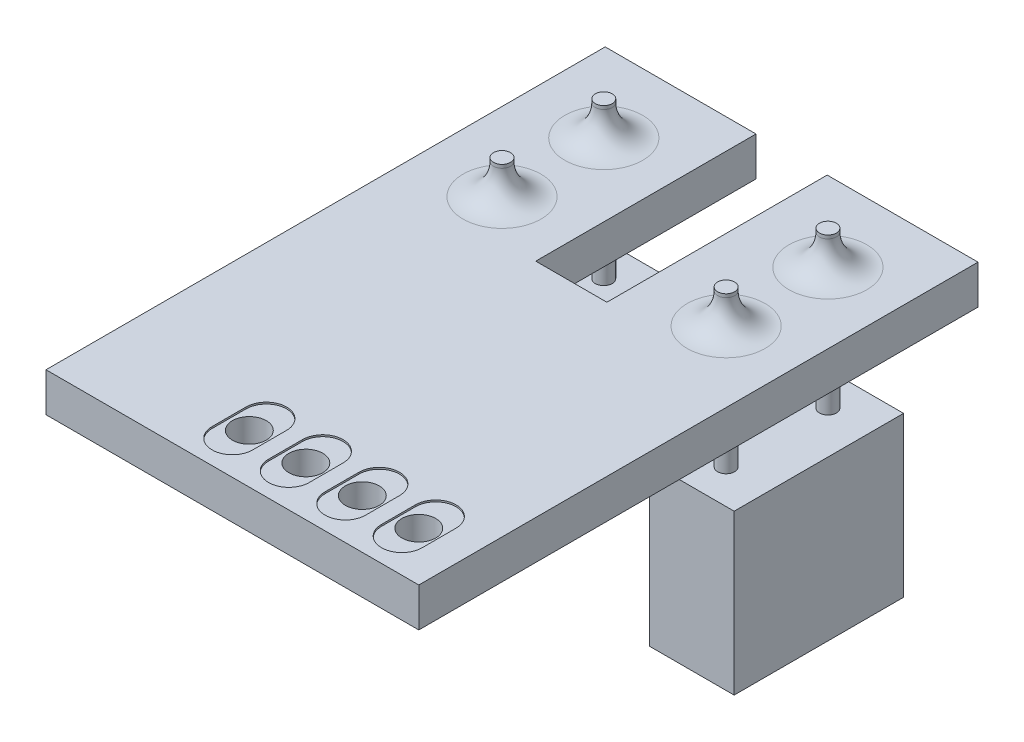
from build123d import *

# Parameters (mm, degrees)
SKETCH1_R                = 0.5
BOSS_EXTRUDE1_DEPTH      = 1.15
BOSS_EXTRUDE2_DEPTH      = 1
BOSS_EXTRUDE2_DEPTH_BACK = 3.6
SKETCH2_R                = 0.25
SKETCH3_W                = 2.5
SKETCH3_H                = 5
BOSS_EXTRUDE3_DEPTH      = 4.7
CUT_EXTRUDE1_DEPTH       = 0.05
FILLET1_R                = 0.9


with BuildPart() as part:
    # Sketch1 → Boss-Extrude1 (new body)
    with BuildSketch(Plane(origin=(0, 0, 0), x_dir=(1, 0, 0), z_dir=(0, 1, 0))):
        Polygon((0, 0), (0, 16.5), (4.45, 16.5), (4.45, 10), (6.55, 10), (6.55, 16.5), (11, 16.5), (11, 0), align=None)
        with Locations((9.5, 1.5)):
            Circle(SKETCH1_R, mode=Mode.SUBTRACT)
        with Locations((7.833333333, 1.5)):
            Circle(SKETCH1_R, mode=Mode.SUBTRACT)
        with Locations((6.166666667, 1.5)):
            Circle(SKETCH1_R, mode=Mode.SUBTRACT)
        with Locations((4.5, 1.5)):
            Circle(SKETCH1_R, mode=Mode.SUBTRACT)
    extrude(amount=BOSS_EXTRUDE1_DEPTH)

    # Sketch2 → Boss-Extrude2 (add, two sides: drawn at the far end of the back side and taken through both)
    with BuildSketch(Plane(origin=(0, 1.15, 0), x_dir=(1, 0, 0), z_dir=(0, 1, 0)).offset(-BOSS_EXTRUDE2_DEPTH_BACK)):
        with Locations((2.303324378, 14.15500421)):
            Circle(SKETCH2_R)
        with Locations((2.303324378, 11.151722015)):
            Circle(SKETCH2_R)
        with Locations((8.916612443, 11.151722015)):
            Circle(SKETCH2_R)
        with Locations((8.916612443, 14.15500421)):
            Circle(SKETCH2_R)
    extrude(amount=BOSS_EXTRUDE2_DEPTH + BOSS_EXTRUDE2_DEPTH_BACK)

    # Sketch3 → Boss-Extrude3 (add)
    with BuildSketch(Plane.XZ.offset(2.45)):
        with Locations((2.303324378, -12.637884748)):
            Rectangle(SKETCH3_W, SKETCH3_H)
        with Locations((8.916612443, -12.637884748)):
            Rectangle(SKETCH3_W, SKETCH3_H)
    extrude(amount=BOSS_EXTRUDE3_DEPTH)

    # Sketch4 → Cut-Extrude1 (cut)
    with BuildSketch(Plane(origin=(0, 1.15, 0), x_dir=(1, 0, 0), z_dir=(0, 1, 0))):
        with BuildLine():
            Line((3.901788048, 1), (3.901788048, 2))
            ThreePointArc((3.901788048, 2), (4.5, 2.598211952), (5.098211952, 2))
            Line((5.098211952, 2), (5.098211952, 1))
            ThreePointArc((5.098211952, 1), (4.5, 0.401788048), (3.901788048, 1))
        make_face()
        with BuildLine():
            Line((5.568454715, 1), (5.568454715, 2))
            ThreePointArc((5.568454715, 2), (6.166666667, 2.598211952), (6.764878619, 2))
            Line((6.764878619, 2), (6.764878619, 1))
            ThreePointArc((6.764878619, 1), (6.166666667, 0.401788048), (5.568454715, 1))
        make_face()
        with BuildLine():
            Line((7.235121381, 1), (7.235121381, 2))
            ThreePointArc((7.235121381, 2), (7.833333333, 2.598211952), (8.431545285, 2))
            Line((8.431545285, 2), (8.431545285, 1))
            ThreePointArc((8.431545285, 1), (7.833333333, 0.401788048), (7.235121381, 1))
        make_face()
        with BuildLine():
            Line((8.901788048, 1), (8.901788048, 2))
            ThreePointArc((8.901788048, 2), (9.5, 2.598211952), (10.098211952, 2))
            Line((10.098211952, 2), (10.098211952, 1))
            ThreePointArc((10.098211952, 1), (9.5, 0.401788048), (8.901788048, 1))
        make_face()
    extrude(amount=-CUT_EXTRUDE1_DEPTH, mode=Mode.SUBTRACT)

    # Fillet1
    fillet1_edges = [part.edges().sort_by_distance(p)[0] for p in [
        (8.666612443, 1.15, -14.15500421),
        (8.666612443, 1.15, -11.151722015),
        (2.053324378, 1.15, -14.15500421),
        (2.053324378, 1.15, -11.151722015),
    ]]
    fillet(fillet1_edges, radius=FILLET1_R)


solid = part.part
